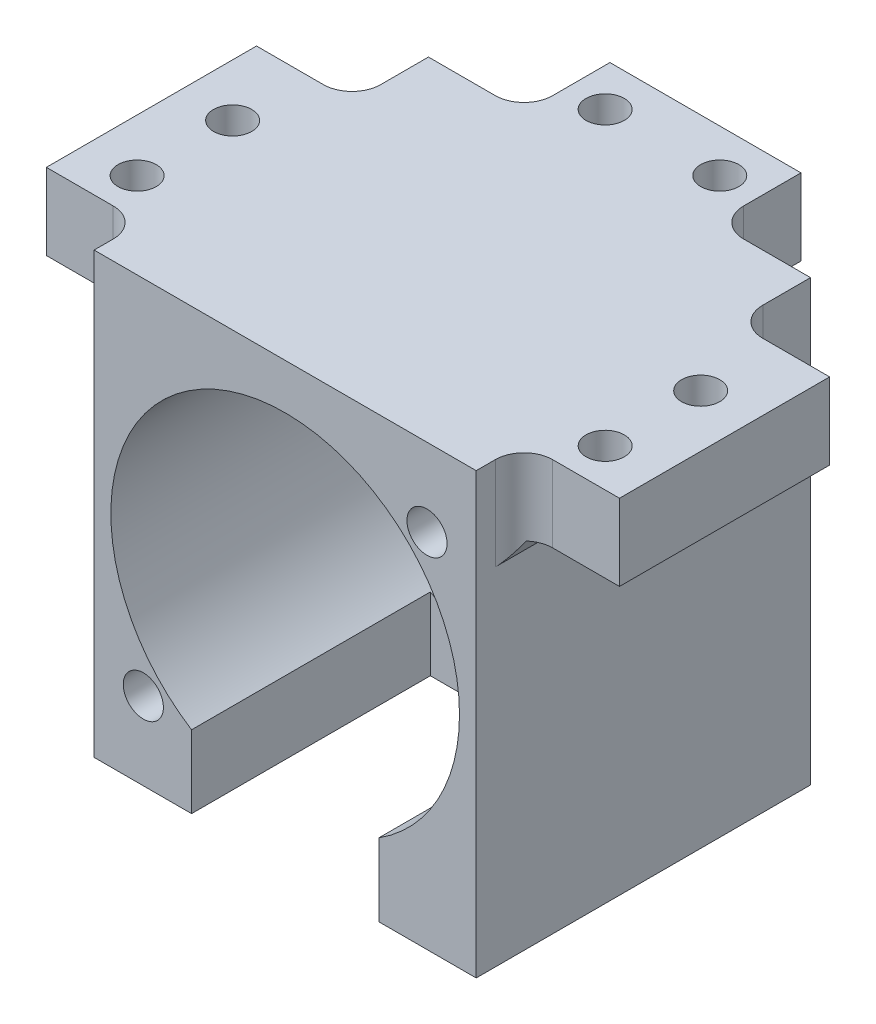
from build123d import *
from OCP.BRepFilletAPI import BRepFilletAPI_MakeChamfer

# Parameters (mm, degrees)
SKETCH_1_W          = 46
SKETCH_1_H          = 46
EXTRUDE_1_DEPTH     = 35
SKETCH_3_R          = 18.25
CUT_EXTRUDE_1_DEPTH = 29
CUT_EXTRUDE_2_DEPTH = 25
SKETCH_5_R          = 2.1
CUT_EXTRUDE_3_DEPTH = 48.780749262
CUT_EXTRUDE_4_DEPTH = 5
SKETCH_7_W          = 3
SKETCH_7_H          = 35
SKETCH_7_H_2        = 35.025411777
CUT_EXTRUDE_5_DEPTH = 61
SKETCH_8_W          = 10
SKETCH_8_H          = 22
SKETCH_8_W_2        = 20
SKETCH_8_H_2        = 9
SKETCH_8_R          = 2
EXTRUDE_2_DEPTH     = 8
SKETCH_9_R          = 2
CUT_EXTRUDE_6_DEPTH = 60.741108125
CHAMFER_1_SIZE      = 1
CHAMFER_1_SIZE2     = 1.732050808
FILLET_2_R          = 3


with BuildPart() as part:
    # 草图1 → 凸台-拉伸1 (new body)
    with BuildSketch(Plane.XY):
        Rectangle(SKETCH_1_W, SKETCH_1_H)
    extrude(amount=EXTRUDE_1_DEPTH)

    # 草图3 → 切除-拉伸1 (cut)
    with BuildSketch(Plane.XY.offset(35)):
        Circle(SKETCH_3_R)
    extrude(amount=-CUT_EXTRUDE_1_DEPTH, mode=Mode.SUBTRACT)

    # 草图4 → 切除-拉伸2 (cut)
    with BuildSketch(Plane.XY.offset(35)):
        with BuildLine():
            ThreePointArc((8.8, -15.988198773), (0, -18.25), (-8.8, -15.988198773))
            Line((-8.8, -15.988198773), (-8.8, -23))
            Line((-8.8, -23), (8.8, -23))
            Line((8.8, -23), (8.8, -15.988198773))
        make_face()
        with BuildLine():
            Line((-8.8, -23), (-8.8, -15.988198773))
            ThreePointArc((-8.8, -15.988198773), (-9.304719908, -15.699830809), (-9.8, -15.395535067))
            Line((-9.8, -15.395535067), (-9.8, -23))
            Line((-9.8, -23), (-8.8, -23))
        make_face()
        Polygon((-8.8, -23.08), (-8.8, -23), (-9.8, -23), (-9.8, -24.08), (9.8, -24.08), (9.8, -23), (8.8, -23), (8.8, -23.08), align=None)
        with BuildLine():
            ThreePointArc((9.8, -15.395535067), (9.304719908, -15.699830809), (8.8, -15.988198773))
            Line((8.8, -15.988198773), (8.8, -23))
            Line((8.8, -23), (9.8, -23))
            Line((9.8, -23), (9.8, -15.395535067))
        make_face()
    extrude(amount=-CUT_EXTRUDE_2_DEPTH, mode=Mode.SUBTRACT)

    # 草图5 → 切除-拉伸3 (cut, through all)
    with BuildSketch(Plane.XY.offset(35)):
        with Locations((-14.849242405, -14.849242405)):
            Circle(SKETCH_5_R)
        with Locations((14.849242405, 14.849242405)):
            Circle(SKETCH_5_R)
    extrude(amount=-CUT_EXTRUDE_3_DEPTH, mode=Mode.SUBTRACT)

    # 草图6 → 切除-拉伸4 (cut)
    with BuildSketch(Plane(origin=(0, 0, 0), x_dir=(-1, 0, 0), z_dir=(0, 0, -1))):
        Polygon((-10.865525548, 14.849242405), (-12.857383976, 18.299242405), (-16.841100834, 18.299242405), (-18.832959262, 14.849242405), (-16.841100834, 11.399242405), (-12.857383976, 11.399242405), align=None)
        Polygon((18.832959262, -14.849242405), (16.841100834, -11.399242405), (12.857383976, -11.399242405), (10.865525548, -14.849242405), (12.857383976, -18.299242405), (16.841100834, -18.299242405), align=None)
    extrude(amount=-CUT_EXTRUDE_4_DEPTH, mode=Mode.SUBTRACT)

    # 草图7 → 切除-拉伸5 (cut)
    with BuildSketch(Plane.XZ.offset(23)):
        with Locations((21.5, 17.5)):
            Rectangle(SKETCH_7_W, SKETCH_7_H)
        with Locations((-21.5, 17.512705889)):
            Rectangle(SKETCH_7_W, SKETCH_7_H_2)
    extrude(amount=-CUT_EXTRUDE_5_DEPTH, mode=Mode.SUBTRACT)

    # 草图8 → 凸台-拉伸2 (add)
    # profile 1 of 3: a face of its own
    with BuildSketch(Plane(origin=(0, 23, 0), x_dir=(1, 0, 0), z_dir=(0, 1, 0))):
        with Locations((25, -19)):
            Rectangle(SKETCH_8_W, SKETCH_8_H)
    # profile 2 of 3: a face of its own
    with BuildSketch(Plane(origin=(0, 23, 0), x_dir=(1, 0, 0), z_dir=(0, 1, 0))):
        with Locations((-25, -19)):
            Rectangle(SKETCH_8_W, SKETCH_8_H)
    # profile 3 of 3: a face of its own
    with BuildSketch(Plane(origin=(0, 23, 0), x_dir=(1, 0, 0), z_dir=(0, 1, 0))):
        with Locations((0, 4.5)):
            Rectangle(SKETCH_8_W_2, SKETCH_8_H_2)
        with Locations(Location((6, 4.5, 0), (0, 0, 270))):
            Circle(SKETCH_8_R, mode=Mode.SUBTRACT)
        with Locations(Location((-6, 4.5, 0), (0, 0, 270))):
            Circle(SKETCH_8_R, mode=Mode.SUBTRACT)
    extrude(amount=-EXTRUDE_2_DEPTH)

    # 草图9 → 切除-拉伸6 (cut, through all)
    with BuildSketch(Plane.XZ.offset(-15)):
        with Locations(Location((24.5, 26, 0), (0, 0, 270))):
            Circle(SKETCH_9_R)
        with Locations(Location((24.5, 16, 0), (0, 0, 270))):
            Circle(SKETCH_9_R)
        with Locations(Location((-24.5, 16, 0), (0, 0, 90))):
            Circle(SKETCH_9_R)
        with Locations(Location((-24.5, 26, 0), (0, 0, 90))):
            Circle(SKETCH_9_R)
    extrude(amount=-CUT_EXTRUDE_6_DEPTH, mode=Mode.SUBTRACT)

    # 倒角1: one chamfer whose edges measure the first distance from different faces: ONE call of the kernel's chamfer builder (chamfer() names one face for all edges)
    chamfer_1_edges_1 = [part.edges().sort_by_distance(p)[0] for p in [
        (20, 15, 19),
    ]]
    chamfer_1_side_1 = [part.faces().sort_by_distance(p)[0] for p in [
        (25.064486824, 15, 18.742052704),
    ]]
    chamfer_1_edges_2 = [part.edges().sort_by_distance(p)[0] for p in [
        (-20, 15, 19),
    ]]
    chamfer_1_side_2 = [part.faces().sort_by_distance(p)[0] for p in [
        (-25.064486824, 15, 18.742052704),
    ]]
    chamfer_1_edges_3 = [part.edges().sort_by_distance(p)[0] for p in [
        (0, 15, 0),
    ]]
    chamfer_1_side_3 = [part.faces().sort_by_distance(p)[0] for p in [
        (0, 15, -4.5),
    ]]
    chamfer_1 = BRepFilletAPI_MakeChamfer(part.part.solid().wrapped)
    for e in chamfer_1_edges_1:
        chamfer_1.Add(CHAMFER_1_SIZE, CHAMFER_1_SIZE2, e.wrapped, chamfer_1_side_1[0].wrapped)  # the first distance lies on this face
    for e in chamfer_1_edges_2:
        chamfer_1.Add(CHAMFER_1_SIZE, CHAMFER_1_SIZE2, e.wrapped, chamfer_1_side_2[0].wrapped)  # the first distance lies on this face
    for e in chamfer_1_edges_3:
        chamfer_1.Add(CHAMFER_1_SIZE, CHAMFER_1_SIZE2, e.wrapped, chamfer_1_side_3[0].wrapped)  # the first distance lies on this face
    add(Compound.cast(chamfer_1.Shape()), mode=Mode.REPLACE)

    # 圆角2
    # the kernel refuses this fillet: 3 mm, written as the material it adds along each edge
    with BuildSketch(Plane(origin=(-20, 23, 30), x_dir=(0, 0, 1), z_dir=(0, -1, 0))) as fillet_2_piece_1_section:
        with BuildLine():
            CenterArc((FILLET_2_R, FILLET_2_R), FILLET_2_R, 180, 90)
            Line((0, FILLET_2_R), (0, 0))
            Line((0, 0), (FILLET_2_R, 0))
        make_face()
    fillet_2_piece_1 = extrude(amount=17.232050808, mode=Mode.PRIVATE)
    fillet_2_piece_1 = split(fillet_2_piece_1, bisect_by=Plane(origin=(-20.640051051, 15, 30.684211078), z_dir=(0, 1, 0)), keep=Keep.TOP, mode=Mode.PRIVATE)
    add(fillet_2_piece_1)
    with BuildSketch(Plane(origin=(-20, 23, 30), x_dir=(0, 0, 1), z_dir=(0, -1, 0))) as fillet_2_piece_2_section:
        with BuildLine():
            CenterArc((FILLET_2_R, FILLET_2_R), FILLET_2_R, 180, 90)
            Line((0, FILLET_2_R), (0, 0))
            Line((0, 0), (FILLET_2_R, 0))
        make_face()
    fillet_2_piece_2 = extrude(amount=17.232050808, mode=Mode.PRIVATE)
    fillet_2_piece_2 = split(fillet_2_piece_2, bisect_by=Plane(origin=(-20.542525514, 14.207630947, 30.942273677), z_dir=(0.8660254037844399, 0.49999999999999784, 0)), keep=Keep.TOP, mode=Mode.PRIVATE)
    add(fillet_2_piece_2)
    with BuildSketch(Plane(origin=(-20, 5.767949192, 8), x_dir=(0, 0, -1), z_dir=(0, 1, 0))) as fillet_2_piece_3_section:
        with BuildLine():
            CenterArc((FILLET_2_R, FILLET_2_R), FILLET_2_R, 180, 90)
            Line((0, FILLET_2_R), (0, 0))
            Line((0, 0), (FILLET_2_R, 0))
        make_face()
    fillet_2_piece_3 = extrude(amount=17.232050808, mode=Mode.PRIVATE)
    fillet_2_piece_3 = split(fillet_2_piece_3, bisect_by=Plane(origin=(-21.788039326, 15, 7.854673445), z_dir=(0, 1, 0)), keep=Keep.TOP, mode=Mode.PRIVATE)
    add(fillet_2_piece_3)
    with BuildSketch(Plane(origin=(-20, 5.767949192, 8), x_dir=(0, 0, -1), z_dir=(0, 1, 0))) as fillet_2_piece_4_section:
        with BuildLine():
            CenterArc((FILLET_2_R, FILLET_2_R), FILLET_2_R, 180, 90)
            Line((0, FILLET_2_R), (0, 0))
            Line((0, 0), (FILLET_2_R, 0))
        make_face()
    fillet_2_piece_4 = extrude(amount=17.232050808, mode=Mode.PRIVATE)
    fillet_2_piece_4 = split(fillet_2_piece_4, bisect_by=Plane(origin=(-20.542525514, 14.207630947, 7.057726323), z_dir=(0.8660254037844399, 0.49999999999999784, 0)), keep=Keep.TOP, mode=Mode.PRIVATE)
    add(fillet_2_piece_4)
    with BuildSketch(Plane(origin=(-10, 23, 0), x_dir=(-1, 0, 0), z_dir=(0, -1, 0))) as fillet_2_piece_5_section:
        with BuildLine():
            CenterArc((FILLET_2_R, FILLET_2_R), FILLET_2_R, 180, 90)
            Line((0, FILLET_2_R), (0, 0))
            Line((0, 0), (FILLET_2_R, 0))
        make_face()
    fillet_2_piece_5 = extrude(amount=17.232050808, mode=Mode.PRIVATE)
    fillet_2_piece_5 = split(fillet_2_piece_5, bisect_by=Plane(origin=(-10.684211078, 17.911025018, -2.680681078), z_dir=(0, 0.49999999999999784, 0.8660254037844399)), keep=Keep.TOP, mode=Mode.PRIVATE)
    add(fillet_2_piece_5)
    with BuildSketch(Plane(origin=(-10, 30.5, 0), x_dir=(-1, 0, 0), z_dir=(0, -1, 0))) as fillet_2_piece_6_section:
        with BuildLine():
            CenterArc((FILLET_2_R, FILLET_2_R), FILLET_2_R, 180, 90)
            Line((0, FILLET_2_R), (0, 0))
            Line((0, 0), (FILLET_2_R, 0))
        make_face()
    fillet_2_piece_6 = extrude(amount=24.732050808, mode=Mode.PRIVATE)
    fillet_2_piece_6 = split(fillet_2_piece_6, bisect_by=Plane(origin=(-10.145326555, 15, -1.788039326), z_dir=(0, 1, 0)), keep=Keep.TOP, mode=Mode.PRIVATE)
    fillet_2_piece_6 = split(fillet_2_piece_6, bisect_by=Plane(origin=(-10.145326555, 15.853077594, -1.492524579), z_dir=(0, -0.49999999999999784, -0.8660254037844399)), keep=Keep.TOP, mode=Mode.PRIVATE)
    add(fillet_2_piece_6)
    with BuildSketch(Plane(origin=(10, 5.767949192, 0), x_dir=(1, 0, 0), z_dir=(0, 1, 0))) as fillet_2_piece_7_section:
        with BuildLine():
            CenterArc((FILLET_2_R, FILLET_2_R), FILLET_2_R, 180, 90)
            Line((0, FILLET_2_R), (0, 0))
            Line((0, 0), (FILLET_2_R, 0))
        make_face()
    fillet_2_piece_7 = extrude(amount=24.732050808, mode=Mode.PRIVATE)
    fillet_2_piece_7 = split(fillet_2_piece_7, bisect_by=Plane(origin=(11.207909256, 14.256216426, -0.228184972), z_dir=(-0.8660254037844387, -0.5, 0)), keep=Keep.TOP, mode=Mode.PRIVATE)
    fillet_2_piece_7 = split(fillet_2_piece_7, bisect_by=Plane(origin=(10.865578652, 13.959723109, -0.399395857), z_dir=(0, 0.49999999999999784, 0.8660254037844399)), keep=Keep.TOP, mode=Mode.PRIVATE)
    add(fillet_2_piece_7)
    with BuildSketch(Plane(origin=(10, 5.767949192, 0), x_dir=(1, 0, 0), z_dir=(0, 1, 0))) as fillet_2_piece_8_section:
        with BuildLine():
            CenterArc((FILLET_2_R, FILLET_2_R), FILLET_2_R, 180, 90)
            Line((0, FILLET_2_R), (0, 0))
            Line((0, 0), (FILLET_2_R, 0))
        make_face()
    fillet_2_piece_8 = extrude(amount=17.232050808, mode=Mode.PRIVATE)
    fillet_2_piece_8 = split(fillet_2_piece_8, bisect_by=Plane(origin=(10.956075536, 15.006079586, -1.705008592), z_dir=(-0.8660254037844386, 0.5000000000000001, 0)), keep=Keep.TOP, mode=Mode.PRIVATE)
    fillet_2_piece_8 = split(fillet_2_piece_8, bisect_by=Plane(origin=(10.158078867, 15, -1.705008592), z_dir=(0, 1, 0)), keep=Keep.TOP, mode=Mode.PRIVATE)
    add(fillet_2_piece_8)
    with BuildSketch(Plane(origin=(10, 5.767949192, 0), x_dir=(1, 0, 0), z_dir=(0, 1, 0))) as fillet_2_piece_9_section:
        with BuildLine():
            CenterArc((FILLET_2_R, FILLET_2_R), FILLET_2_R, 180, 90)
            Line((0, FILLET_2_R), (0, 0))
            Line((0, 0), (FILLET_2_R, 0))
        make_face()
    fillet_2_piece_9 = extrude(amount=17.232050808, mode=Mode.PRIVATE)
    fillet_2_piece_9 = split(fillet_2_piece_9, bisect_by=Plane(origin=(10.908693088, 14.924010778, -0.446987958), z_dir=(-0.8660254037844386, 0.5000000000000001, 0)), keep=Keep.TOP, mode=Mode.PRIVATE)
    fillet_2_piece_9 = split(fillet_2_piece_9, bisect_by=Plane(origin=(10.864092139, 14.722859622, -0.839992928), z_dir=(0, 0.49999999999999784, 0.8660254037844399)), keep=Keep.TOP, mode=Mode.PRIVATE)
    add(fillet_2_piece_9)
    with BuildSketch(Plane(origin=(10, 5.767949192, 0), x_dir=(1, 0, 0), z_dir=(0, 1, 0))) as fillet_2_piece_10_section:
        with BuildLine():
            CenterArc((FILLET_2_R, FILLET_2_R), FILLET_2_R, 180, 90)
            Line((0, FILLET_2_R), (0, 0))
            Line((0, 0), (FILLET_2_R, 0))
        make_face()
    fillet_2_piece_10 = extrude(amount=17.232050808, mode=Mode.PRIVATE)
    fillet_2_piece_10 = split(fillet_2_piece_10, bisect_by=Plane(origin=(12.9144267, 18.299242405, -0.000678235), z_dir=(0, 1, 0)), keep=Keep.TOP, mode=Mode.PRIVATE)
    add(fillet_2_piece_10)
    with BuildSketch(Plane(origin=(20, 23, 8), x_dir=(0, 0, -1), z_dir=(0, -1, 0))) as fillet_2_piece_11_section:
        with BuildLine():
            CenterArc((FILLET_2_R, FILLET_2_R), FILLET_2_R, 180, 90)
            Line((0, FILLET_2_R), (0, 0))
            Line((0, 0), (FILLET_2_R, 0))
        make_face()
    fillet_2_piece_11 = extrude(amount=17.232050808, mode=Mode.PRIVATE)
    fillet_2_piece_11 = split(fillet_2_piece_11, bisect_by=Plane(origin=(20.640051051, 15, 7.315788922), z_dir=(0, 1, 0)), keep=Keep.TOP, mode=Mode.PRIVATE)
    add(fillet_2_piece_11)
    with BuildSketch(Plane(origin=(20, 23, 8), x_dir=(0, 0, -1), z_dir=(0, -1, 0))) as fillet_2_piece_12_section:
        with BuildLine():
            CenterArc((FILLET_2_R, FILLET_2_R), FILLET_2_R, 180, 90)
            Line((0, FILLET_2_R), (0, 0))
            Line((0, 0), (FILLET_2_R, 0))
        make_face()
    fillet_2_piece_12 = extrude(amount=17.232050808, mode=Mode.PRIVATE)
    fillet_2_piece_12 = split(fillet_2_piece_12, bisect_by=Plane(origin=(20.542525514, 14.207630947, 7.057726323), z_dir=(-0.8660254037844399, 0.49999999999999784, 0)), keep=Keep.TOP, mode=Mode.PRIVATE)
    add(fillet_2_piece_12)
    with BuildSketch(Plane(origin=(20, 5.767949192, 30), x_dir=(0, 0, 1), z_dir=(0, 1, 0))) as fillet_2_piece_13_section:
        with BuildLine():
            CenterArc((FILLET_2_R, FILLET_2_R), FILLET_2_R, 180, 90)
            Line((0, FILLET_2_R), (0, 0))
            Line((0, 0), (FILLET_2_R, 0))
        make_face()
    fillet_2_piece_13 = extrude(amount=17.232050808, mode=Mode.PRIVATE)
    fillet_2_piece_13 = split(fillet_2_piece_13, bisect_by=Plane(origin=(21.788039326, 15, 30.145326555), z_dir=(0, 1, 0)), keep=Keep.TOP, mode=Mode.PRIVATE)
    add(fillet_2_piece_13)
    with BuildSketch(Plane(origin=(20, 5.767949192, 30), x_dir=(0, 0, 1), z_dir=(0, 1, 0))) as fillet_2_piece_14_section:
        with BuildLine():
            CenterArc((FILLET_2_R, FILLET_2_R), FILLET_2_R, 180, 90)
            Line((0, FILLET_2_R), (0, 0))
            Line((0, 0), (FILLET_2_R, 0))
        make_face()
    fillet_2_piece_14 = extrude(amount=17.232050808, mode=Mode.PRIVATE)
    fillet_2_piece_14 = split(fillet_2_piece_14, bisect_by=Plane(origin=(20.542525514, 14.207630947, 30.942273677), z_dir=(-0.8660254037844399, 0.49999999999999784, 0)), keep=Keep.TOP, mode=Mode.PRIVATE)
    add(fillet_2_piece_14)


solid = part.part
